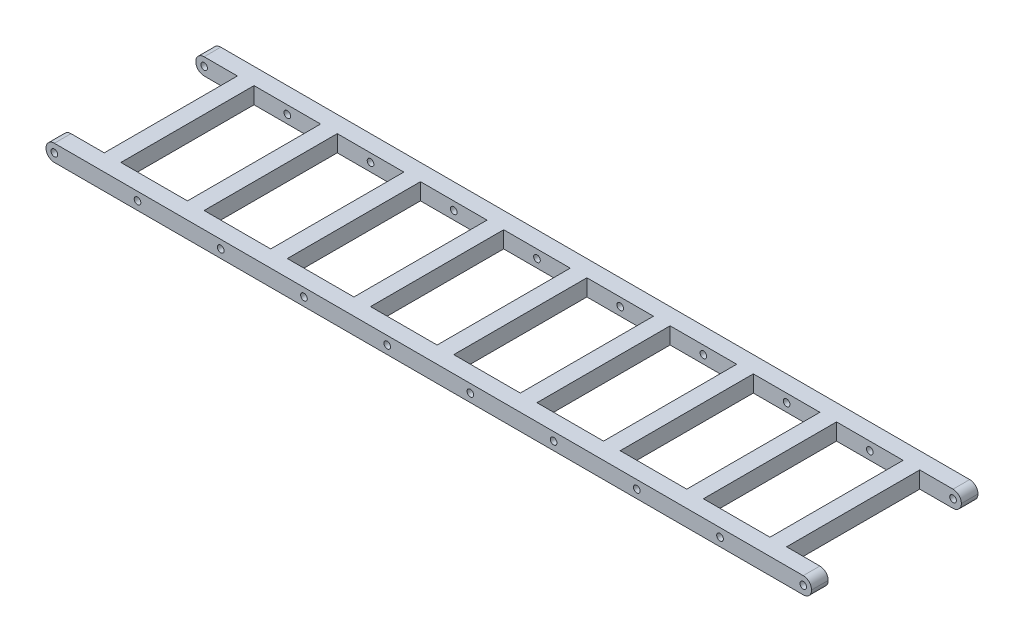
from build123d import *

# Parameters (mm, degrees)
SKETCH1_W           = 25.4
SKETCH1_H           = 50.8
BOSS_EXTRUDE1_DEPTH = 6.35
CUT_EXTRUDE1_REACH  = 161.384
SKETCH2_R           = 1.27
FILLET2_R           = 3.175


with BuildPart() as part:
    # Sketch1 → Boss-Extrude1 (new body)
    with BuildSketch(Plane(origin=(0, 0, 0), x_dir=(1, 0, 0), z_dir=(0, 1, 0))):
        Polygon((-146.05, 25.4), (-130.175, 25.4), (-130.175, -25.4), (-146.05, -25.4), (-146.05, -31.75), (146.05, -31.75), (146.05, -25.4), (130.175, -25.4), (130.175, 25.4), (146.05, 25.4), (146.05, 31.75), (-146.05, 31.75), align=None)
        with Locations((-15.875, 0)):
            Rectangle(SKETCH1_W, SKETCH1_H, mode=Mode.SUBTRACT)
        with Locations((111.125, 0)):
            Rectangle(SKETCH1_W, SKETCH1_H, mode=Mode.SUBTRACT)
        with Locations((-47.625, 0)):
            Rectangle(SKETCH1_W, SKETCH1_H, mode=Mode.SUBTRACT)
        with Locations((-79.375, 0)):
            Rectangle(SKETCH1_W, SKETCH1_H, mode=Mode.SUBTRACT)
        with Locations((-111.125, 0)):
            Rectangle(SKETCH1_W, SKETCH1_H, mode=Mode.SUBTRACT)
        with Locations((79.375, 0)):
            Rectangle(SKETCH1_W, SKETCH1_H, mode=Mode.SUBTRACT)
        with Locations((47.625, 0)):
            Rectangle(SKETCH1_W, SKETCH1_H, mode=Mode.SUBTRACT)
        with Locations((15.875, 0)):
            Rectangle(SKETCH1_W, SKETCH1_H, mode=Mode.SUBTRACT)
    extrude(amount=-BOSS_EXTRUDE1_DEPTH)

    # Cut-Extrude1: up to this face of the body (flat: up to its plane)
    cut_extrude1_end = Plane(part.part.faces().sort_by_distance((0, -3.175, -31.75))[0])
    # Sketch2 → Cut-Extrude1 (cut, up to the picked face)
    with BuildSketch(Plane.XY.offset(31.75), mode=Mode.PRIVATE) as cut_extrude1_sk1:
        with Locations((-142.875, -3.175)):
            Circle(SKETCH2_R)
    cut_extrude1_tool1 = split(extrude(cut_extrude1_sk1.sketch, amount=-CUT_EXTRUDE1_REACH, mode=Mode.PRIVATE), bisect_by=cut_extrude1_end, keep=Keep.BOTH, mode=Mode.PRIVATE)
    # Sketch2 → Cut-Extrude1 (cut, up to the picked face)
    with BuildSketch(Plane.XY.offset(31.75), mode=Mode.PRIVATE) as cut_extrude1_sk2:
        with Locations((-111.125, -3.175)):
            Circle(SKETCH2_R)
    cut_extrude1_tool2 = split(extrude(cut_extrude1_sk2.sketch, amount=-CUT_EXTRUDE1_REACH, mode=Mode.PRIVATE), bisect_by=cut_extrude1_end, keep=Keep.BOTH, mode=Mode.PRIVATE)
    # Sketch2 → Cut-Extrude1 (cut, up to the picked face)
    with BuildSketch(Plane.XY.offset(31.75), mode=Mode.PRIVATE) as cut_extrude1_sk3:
        with Locations((-79.375, -3.175)):
            Circle(SKETCH2_R)
    cut_extrude1_tool3 = split(extrude(cut_extrude1_sk3.sketch, amount=-CUT_EXTRUDE1_REACH, mode=Mode.PRIVATE), bisect_by=cut_extrude1_end, keep=Keep.BOTH, mode=Mode.PRIVATE)
    # Sketch2 → Cut-Extrude1 (cut, up to the picked face)
    with BuildSketch(Plane.XY.offset(31.75), mode=Mode.PRIVATE) as cut_extrude1_sk4:
        with Locations((-47.625, -3.175)):
            Circle(SKETCH2_R)
    cut_extrude1_tool4 = split(extrude(cut_extrude1_sk4.sketch, amount=-CUT_EXTRUDE1_REACH, mode=Mode.PRIVATE), bisect_by=cut_extrude1_end, keep=Keep.BOTH, mode=Mode.PRIVATE)
    # Sketch2 → Cut-Extrude1 (cut, up to the picked face)
    with BuildSketch(Plane.XY.offset(31.75), mode=Mode.PRIVATE) as cut_extrude1_sk5:
        with Locations((-15.875, -3.175)):
            Circle(SKETCH2_R)
    cut_extrude1_tool5 = split(extrude(cut_extrude1_sk5.sketch, amount=-CUT_EXTRUDE1_REACH, mode=Mode.PRIVATE), bisect_by=cut_extrude1_end, keep=Keep.BOTH, mode=Mode.PRIVATE)
    # Sketch2 → Cut-Extrude1 (cut, up to the picked face)
    with BuildSketch(Plane.XY.offset(31.75), mode=Mode.PRIVATE) as cut_extrude1_sk6:
        with Locations((15.875, -3.175)):
            Circle(SKETCH2_R)
    cut_extrude1_tool6 = split(extrude(cut_extrude1_sk6.sketch, amount=-CUT_EXTRUDE1_REACH, mode=Mode.PRIVATE), bisect_by=cut_extrude1_end, keep=Keep.BOTH, mode=Mode.PRIVATE)
    # Sketch2 → Cut-Extrude1 (cut, up to the picked face)
    with BuildSketch(Plane.XY.offset(31.75), mode=Mode.PRIVATE) as cut_extrude1_sk7:
        with Locations((47.625, -3.175)):
            Circle(SKETCH2_R)
    cut_extrude1_tool7 = split(extrude(cut_extrude1_sk7.sketch, amount=-CUT_EXTRUDE1_REACH, mode=Mode.PRIVATE), bisect_by=cut_extrude1_end, keep=Keep.BOTH, mode=Mode.PRIVATE)
    # Sketch2 → Cut-Extrude1 (cut, up to the picked face)
    with BuildSketch(Plane.XY.offset(31.75), mode=Mode.PRIVATE) as cut_extrude1_sk8:
        with Locations((79.375, -3.175)):
            Circle(SKETCH2_R)
    cut_extrude1_tool8 = split(extrude(cut_extrude1_sk8.sketch, amount=-CUT_EXTRUDE1_REACH, mode=Mode.PRIVATE), bisect_by=cut_extrude1_end, keep=Keep.BOTH, mode=Mode.PRIVATE)
    # Sketch2 → Cut-Extrude1 (cut, up to the picked face)
    with BuildSketch(Plane.XY.offset(31.75), mode=Mode.PRIVATE) as cut_extrude1_sk9:
        with Locations((111.125, -3.175)):
            Circle(SKETCH2_R)
    cut_extrude1_tool9 = split(extrude(cut_extrude1_sk9.sketch, amount=-CUT_EXTRUDE1_REACH, mode=Mode.PRIVATE), bisect_by=cut_extrude1_end, keep=Keep.BOTH, mode=Mode.PRIVATE)
    # Sketch2 → Cut-Extrude1 (cut, up to the picked face)
    with BuildSketch(Plane.XY.offset(31.75), mode=Mode.PRIVATE) as cut_extrude1_sk10:
        with Locations((142.875, -3.175)):
            Circle(SKETCH2_R)
    cut_extrude1_tool10 = split(extrude(cut_extrude1_sk10.sketch, amount=-CUT_EXTRUDE1_REACH, mode=Mode.PRIVATE), bisect_by=cut_extrude1_end, keep=Keep.BOTH, mode=Mode.PRIVATE)
    add(cut_extrude1_tool1.solids().sort_by(Axis((-142.875, -3.175, 31.75), (0, 0, -1)))[0], mode=Mode.SUBTRACT)
    add(cut_extrude1_tool2.solids().sort_by(Axis((-111.125, -3.175, 31.75), (0, 0, -1)))[0], mode=Mode.SUBTRACT)
    add(cut_extrude1_tool3.solids().sort_by(Axis((-79.375, -3.175, 31.75), (0, 0, -1)))[0], mode=Mode.SUBTRACT)
    add(cut_extrude1_tool4.solids().sort_by(Axis((-47.625, -3.175, 31.75), (0, 0, -1)))[0], mode=Mode.SUBTRACT)
    add(cut_extrude1_tool5.solids().sort_by(Axis((-15.875, -3.175, 31.75), (0, 0, -1)))[0], mode=Mode.SUBTRACT)
    add(cut_extrude1_tool6.solids().sort_by(Axis((15.875, -3.175, 31.75), (0, 0, -1)))[0], mode=Mode.SUBTRACT)
    add(cut_extrude1_tool7.solids().sort_by(Axis((47.625, -3.175, 31.75), (0, 0, -1)))[0], mode=Mode.SUBTRACT)
    add(cut_extrude1_tool8.solids().sort_by(Axis((79.375, -3.175, 31.75), (0, 0, -1)))[0], mode=Mode.SUBTRACT)
    add(cut_extrude1_tool9.solids().sort_by(Axis((111.125, -3.175, 31.75), (0, 0, -1)))[0], mode=Mode.SUBTRACT)
    add(cut_extrude1_tool10.solids().sort_by(Axis((142.875, -3.175, 31.75), (0, 0, -1)))[0], mode=Mode.SUBTRACT)

    # Fillet2
    fillet2_edges = [part.edges().sort_by_distance(p)[0] for p in [
        (-146.05, -6.35, 28.575),
        (-146.05, 0, 28.575),
        (-146.05, -6.35, -28.575),
        (-146.05, 0, -28.575),
        (146.05, -6.35, -28.575),
        (146.05, 0, -28.575),
        (146.05, -6.35, 28.575),
        (146.05, 0, 28.575),
    ]]
    fillet(fillet2_edges, radius=FILLET2_R - 0.0001)  # a hair under: the kernel refuses the full size


solid = part.part
